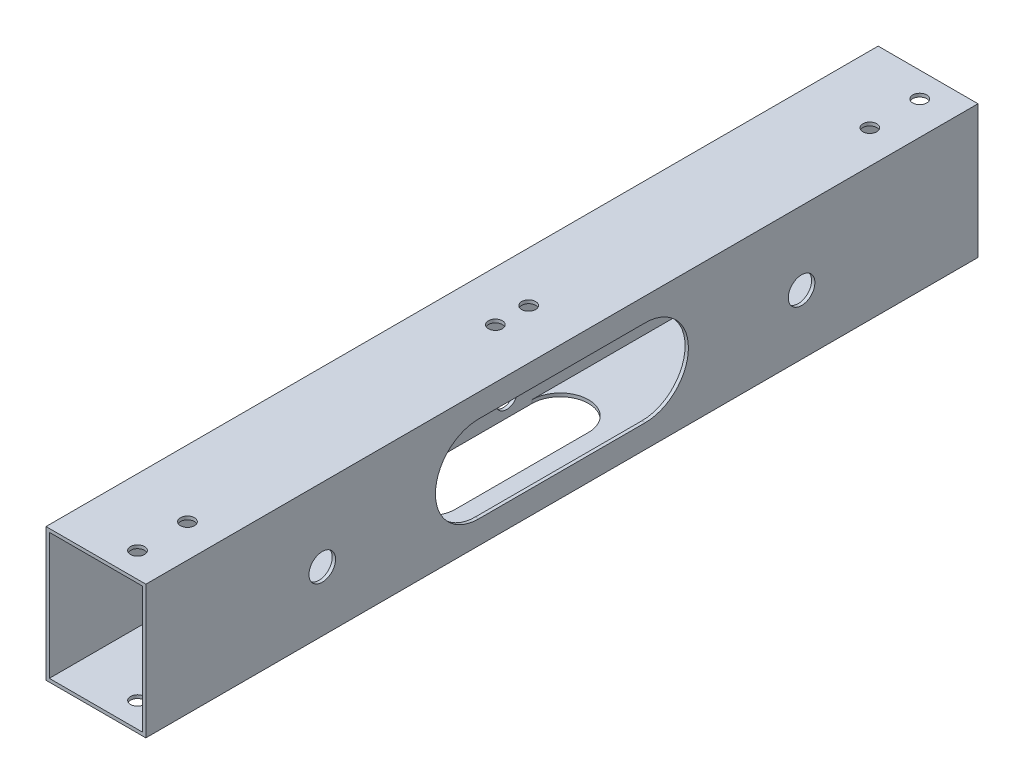
from build123d import *

# Parameters (mm, degrees)
SKETCH_1_W          = 30
SKETCH_1_H          = 40
SKETCH_1_W_2        = 28
SKETCH_1_H_2        = 38
EXTRUDE_1_DEPTH     = 250
SKETCH_3_R          = 2.1
CUT_EXTRUDE_1_DEPTH = 250
SKETCH_4_R          = 4
CUT_EXTRUDE_2_DEPTH = 250
SKETCH_5_R          = 7
CUT_EXTRUDE_3_DEPTH = 250
CUT_EXTRUDE_4_DEPTH = 20
CUT_EXTRUDE_6_DEPTH = 22
SKETCH_8_R          = 3.25
CUT_EXTRUDE_7_DEPTH = 22


with BuildPart() as part:
    # 草图1 → 凸台-拉伸1 (new body)
    with BuildSketch(Plane.XY):
        Rectangle(SKETCH_1_W, SKETCH_1_H)
        Rectangle(SKETCH_1_W_2, SKETCH_1_H_2, mode=Mode.SUBTRACT)
    extrude(amount=EXTRUDE_1_DEPTH)

    # 草图3 → 切除-拉伸1 (cut)
    with BuildSketch(Plane(origin=(0, 20, 0), x_dir=(1, 0, 0), z_dir=(0, 1, 0))):
        with Locations((5, -7.5)):
            Circle(SKETCH_3_R)
        with Locations((5, -22.5)):
            Circle(SKETCH_3_R)
        with Locations((5, -227.5)):
            Circle(SKETCH_3_R)
        with Locations((5, -242.5)):
            Circle(SKETCH_3_R)
        with Locations((0, -120)):
            Circle(SKETCH_3_R)
        with Locations((0, -130)):
            Circle(SKETCH_3_R)
    extrude(amount=-CUT_EXTRUDE_1_DEPTH, mode=Mode.SUBTRACT)

    # 草图4 → 切除-拉伸2 (cut)
    with BuildSketch(Plane(origin=(15, 0, 0), x_dir=(0, 0, -1), z_dir=(1, 0, 0))):
        with Locations((-53, -2)):
            Circle(SKETCH_4_R)
        with Locations((-197, -2)):
            Circle(SKETCH_4_R)
    extrude(amount=-CUT_EXTRUDE_2_DEPTH, mode=Mode.SUBTRACT)

    # 草图5 → 切除-拉伸3 (cut)
    with BuildSketch(Plane.ZY.offset(15)):
        with Locations((125, -2)):
            Circle(SKETCH_5_R)
    extrude(amount=-CUT_EXTRUDE_3_DEPTH, mode=Mode.SUBTRACT)

    # 草图6 → 切除-拉伸4 (cut)
    with BuildSketch(Plane.XZ.offset(20)):
        with BuildLine():
            Line((-14, 145), (-14, 105))
            ThreePointArc((-14, 105), (-5.5, 96.5), (3, 105))
            Line((3, 105), (3, 145))
            ThreePointArc((3, 145), (-5.5, 153.5), (-14, 145))
        make_face()
    extrude(amount=-CUT_EXTRUDE_4_DEPTH, mode=Mode.SUBTRACT)

    # 草图7 → 切除-拉伸6 (cut)
    with BuildSketch(Plane(origin=(15, 0, 0), x_dir=(0, 0, -1), z_dir=(1, 0, 0))):
        with BuildLine():
            Line((-150, 13), (-100, 13))
            ThreePointArc((-100, 13), (-87, 0), (-100, -13))
            Line((-100, -13), (-150, -13))
            ThreePointArc((-150, -13), (-163, 0), (-150, 13))
        make_face()
    extrude(amount=-CUT_EXTRUDE_6_DEPTH, mode=Mode.SUBTRACT)

    # 草图8 → 切除-拉伸7 (cut)
    with BuildSketch(Plane.ZY.offset(15)):
        with Locations((112.625, -14.5)):
            Circle(SKETCH_8_R)
        with Locations((137.375, -14.5)):
            Circle(SKETCH_8_R)
        with Locations((112.625, 10.25)):
            Circle(SKETCH_8_R)
        with Locations((137.375, 10.25)):
            Circle(SKETCH_8_R)
    extrude(amount=-CUT_EXTRUDE_7_DEPTH, mode=Mode.SUBTRACT)


solid = part.part
